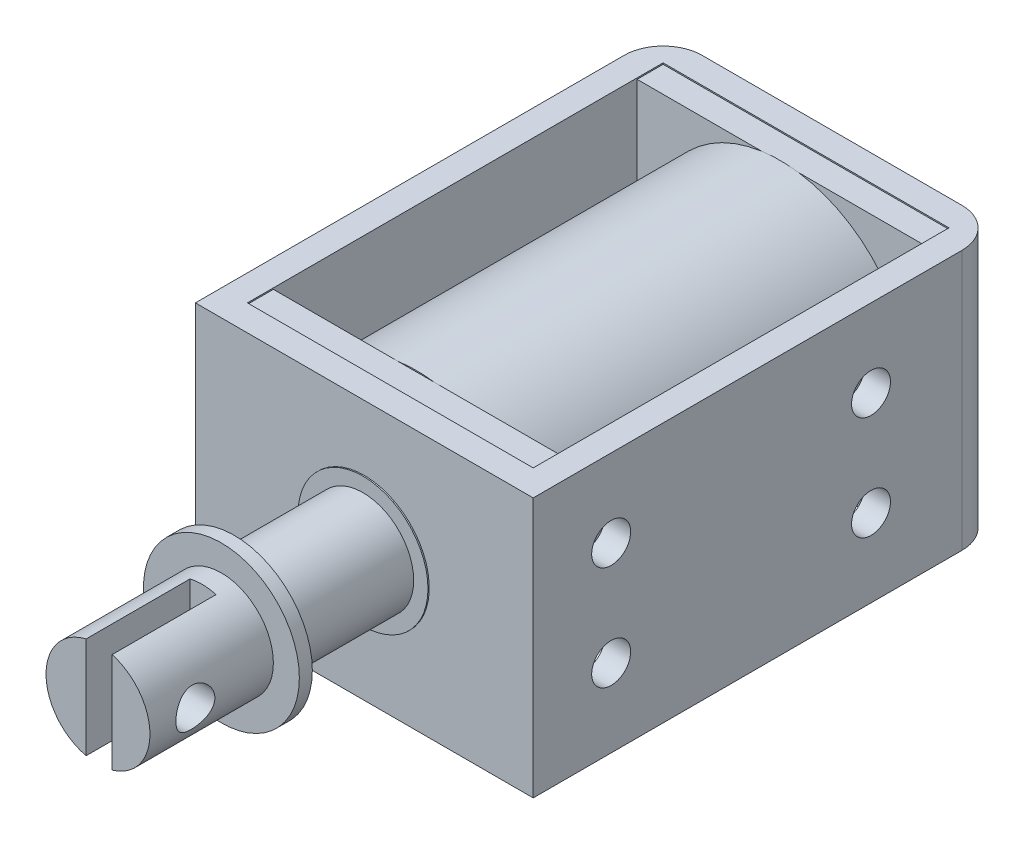
from build123d import *

# Parameters (mm, degrees)
SKETCH1_W               = 26
SKETCH1_H               = 36
BOSS_EXTRUDE1_DEPTH     = 20
FILLET1_R               = 3
SKETCH2_W               = 22
SKETCH2_H               = 32
CUT_EXTRUDE1_DEPTH      = 20
SKETCH5_W               = 22
SKETCH5_H               = 20
BOSS_EXTRUDE3_DEPTH     = 2
SKETCH6_W               = 22
SKETCH6_H               = 20
BOSS_EXTRUDE4_DEPTH     = 2
SKETCH7_R               = 10
BOSS_EXTRUDE5_DEPTH     = 28
SKETCH8_R               = 3
BOSS_EXTRUDE6_DEPTH     = 0.5
SKETCH9_R               = 3
BOSS_EXTRUDE7_DEPTH     = 2
FILLET2_R               = 1
BOSS_EXTRUDE8_DEPTH     = 2
SKETCH11_R              = 2.6
BOSS_EXTRUDE9_DEPTH     = 3
FILLET4_R               = 2
SKETCH12_R              = 3.9
BOSS_EXTRUDE10_DEPTH    = 10
SKETCH13_R              = 6
BOSS_EXTRUDE11_DEPTH    = 1
SKETCH14_R              = 4
BOSS_EXTRUDE12_DEPTH    = 9.5
SKETCH15_W              = 2
SKETCH15_H              = 8
CUT_EXTRUDE3_DEPTH      = 8
CUT_EXTRUDE4_DEPTH      = 5
CUT_EXTRUDE4_DEPTH_BACK = 5
SKETCH16_R              = 1.5
SKETCH17_R              = 5
BOSS_EXTRUDE13_DEPTH    = 0.1
SKETCH18_R              = 1.5
CUT_EXTRUDE5_DEPTH      = 2


with BuildPart() as part:
    # Sketch1 → Boss-Extrude1 (new body)
    with BuildSketch(Plane(origin=(0, 0, 0), x_dir=(1, 0, 0), z_dir=(0, 1, 0))):
        Rectangle(SKETCH1_W, SKETCH1_H)
    extrude(amount=BOSS_EXTRUDE1_DEPTH)

    # Fillet1
    fillet1_edges = [part.edges().sort_by_distance(p)[0] for p in [
        (-13, 10, -18),
        (13, 10, -18),
    ]]
    fillet(fillet1_edges, radius=FILLET1_R)

    # Sketch2 → Cut-Extrude1 (cut)
    with BuildSketch(Plane(origin=(0, 20, 0), x_dir=(1, 0, 0), z_dir=(0, 1, 0))):
        Rectangle(SKETCH2_W, SKETCH2_H)
    extrude(amount=-CUT_EXTRUDE1_DEPTH, mode=Mode.SUBTRACT)

    # Sketch5 → Boss-Extrude3 (add)
    with BuildSketch(Plane.XY.offset(-16)):
        with Locations((0, 9.9)):
            Rectangle(SKETCH5_W, SKETCH5_H)
    extrude(amount=BOSS_EXTRUDE3_DEPTH)

    # Sketch6 → Boss-Extrude4 (add)
    with BuildSketch(Plane(origin=(0, 0, 16), x_dir=(-1, 0, 0), z_dir=(0, 0, -1))):
        with Locations((0, 9.9)):
            Rectangle(SKETCH6_W, SKETCH6_H)
    extrude(amount=BOSS_EXTRUDE4_DEPTH)

    # Sketch7 → Boss-Extrude5 (add)
    with BuildSketch(Plane(origin=(0, 0, 14), x_dir=(-1, 0, 0), z_dir=(0, 0, -1))):
        with Locations(Location((0, 10, 0), (0, 0, 98.109614456))):
            Circle(SKETCH7_R)
    extrude(amount=BOSS_EXTRUDE5_DEPTH)

    # Sketch8 → Boss-Extrude6 (add)
    with BuildSketch(Plane(origin=(0, 0, -18), x_dir=(-1, 0, 0), z_dir=(0, 0, -1))):
        with Locations(Location((0, 10, 0), (0, 0, 180))):
            Circle(SKETCH8_R)
    extrude(amount=BOSS_EXTRUDE6_DEPTH)

    # Sketch12 → Boss-Extrude10 (add)
    with BuildSketch(Plane.XY.offset(18)):
        with Locations((0, 10)):
            Circle(SKETCH12_R)
    extrude(amount=BOSS_EXTRUDE10_DEPTH)

    # Sketch13 → Boss-Extrude11 (add)
    with BuildSketch(Plane.XY.offset(28)):
        with Locations((0, 10)):
            Circle(SKETCH13_R)
    extrude(amount=BOSS_EXTRUDE11_DEPTH)

    # Sketch14 → Boss-Extrude12 (add)
    with BuildSketch(Plane.XY.offset(29)):
        with Locations((0, 10)):
            Circle(SKETCH14_R)
    extrude(amount=BOSS_EXTRUDE12_DEPTH)

    # Sketch15 → Cut-Extrude3 (cut)
    with BuildSketch(Plane.XY.offset(38.5)):
        with Locations((0.08840706, 10)):
            Rectangle(SKETCH15_W, SKETCH15_H)
    extrude(amount=-CUT_EXTRUDE3_DEPTH, mode=Mode.SUBTRACT)

    # Sketch16 → Cut-Extrude4 (cut, two sides: drawn at the far end of the back side and taken through both)
    with BuildSketch(Plane(origin=(-0.91159294, 0, 0), x_dir=(0, 0, -1), z_dir=(1, 0, 0)).offset(-CUT_EXTRUDE4_DEPTH_BACK)):
        with Locations(Location((-35, 9.894739826, 0), (0, 0, 180))):
            Circle(SKETCH16_R)
    extrude(amount=CUT_EXTRUDE4_DEPTH + CUT_EXTRUDE4_DEPTH_BACK, mode=Mode.SUBTRACT)

    # Sketch17 → Boss-Extrude13 (add)
    with BuildSketch(Plane.XY.offset(18)):
        with Locations(Location((0, 10, 0), (0, 0, 180))):
            Circle(SKETCH17_R)
    extrude(amount=BOSS_EXTRUDE13_DEPTH)

    # Sketch18 → Cut-Extrude5 (cut)
    with BuildSketch(Plane(origin=(13, 0, 0), x_dir=(0, 0, -1), z_dir=(1, 0, 0))):
        with Locations((-12, 14)):
            Circle(SKETCH18_R)
        with Locations((8, 14)):
            Circle(SKETCH18_R)
        with Locations((8, 6)):
            Circle(SKETCH18_R)
        with Locations((-12, 6)):
            Circle(SKETCH18_R)
    extrude(amount=-CUT_EXTRUDE5_DEPTH, mode=Mode.SUBTRACT)


with BuildPart() as body_2:
    # Sketch9 → Boss-Extrude7 (new body)
    with BuildSketch(Plane(origin=(0, 0, -18.5), x_dir=(-1, 0, 0), z_dir=(0, 0, -1))):
        with Locations((0, 10)):
            Circle(SKETCH9_R)
    extrude(amount=BOSS_EXTRUDE7_DEPTH)

    # Fillet2
    fillet2_edges = [body_2.edges().sort_by_distance(p)[0] for p in [
        (3, 10, -18.5),
        (3, 10, -20.5),
    ]]
    fillet(fillet2_edges, radius=FILLET2_R - 0.0001)  # a hair under: the kernel refuses the full size

    # Sketch10 → Boss-Extrude8 (add)
    with BuildSketch(Plane(origin=(0, 0, -20.5), x_dir=(-1, 0, 0), z_dir=(0, 0, -1))):
        Polygon((3.0022214, 10), (1.5011107, 12.6), (-1.5011107, 12.6), (-3.0022214, 10), (-1.5011107, 7.4), (1.5011107, 7.4), align=None)
    extrude(amount=BOSS_EXTRUDE8_DEPTH)

    # Sketch11 → Boss-Extrude9 (add)
    with BuildSketch(Plane(origin=(0, 0, -22.5), x_dir=(-1, 0, 0), z_dir=(0, 0, -1))):
        with Locations(Location((0, 10, 0), (0, 0, 150))):
            Circle(SKETCH11_R)
    extrude(amount=BOSS_EXTRUDE9_DEPTH)

    # Fillet4
    fillet4_edges = [body_2.edges().sort_by_distance(p)[0] for p in [
        (-2.25166605, 8.7, -25.5),
    ]]
    fillet(fillet4_edges, radius=FILLET4_R)


solid = Compound([part.part, body_2.part])
